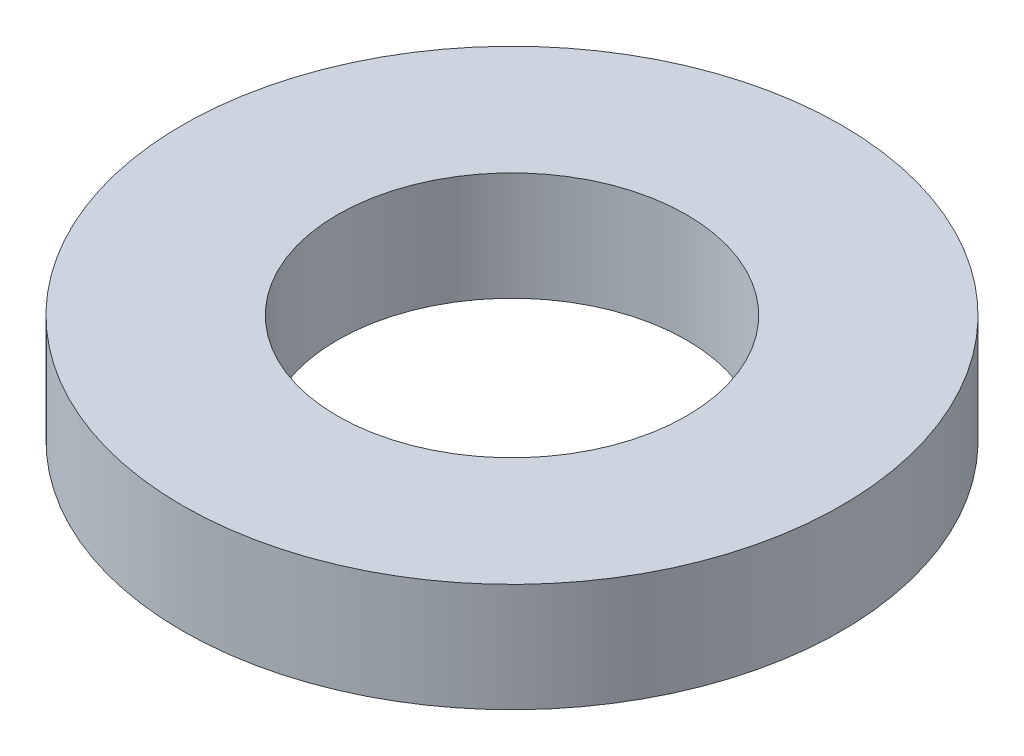
from build123d import *

# Parameters (mm, degrees)
SKETCH1_R           = 42.5
BOSS_EXTRUDE1_DEPTH = 14
SKETCH2_R           = 22.5
CUT_EXTRUDE1_DEPTH  = 62.713045622


with BuildPart() as part:
    # Sketch1 → Boss-Extrude1 (new body)
    with BuildSketch(Plane(origin=(0, 0, 0), x_dir=(1, 0, 0), z_dir=(0, 1, 0))):
        Circle(SKETCH1_R)
    extrude(amount=BOSS_EXTRUDE1_DEPTH)

    # Sketch2 → Cut-Extrude1 (cut, through all)
    with BuildSketch(Plane(origin=(0, 0, 0), x_dir=(1, 0, 0), z_dir=(0, 1, 0))):
        Circle(SKETCH2_R)
    extrude(amount=CUT_EXTRUDE1_DEPTH, mode=Mode.SUBTRACT)


solid = part.part
